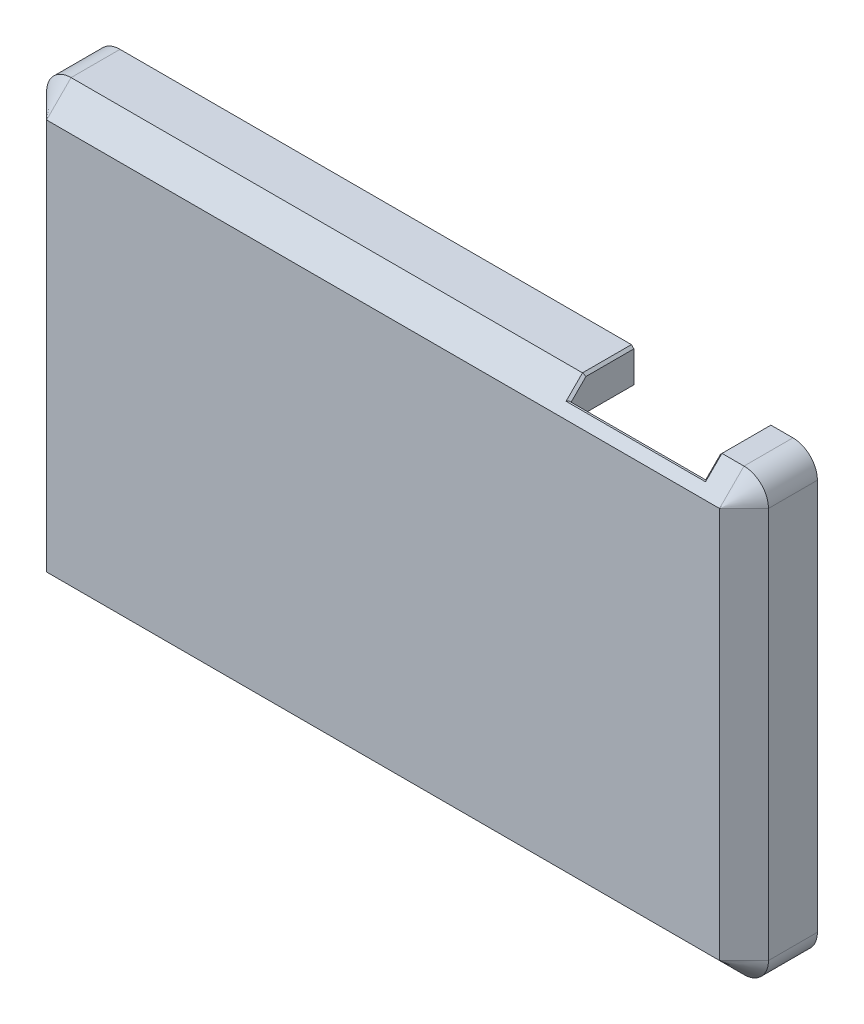
from build123d import *
from OCP.BRepFilletAPI import BRepFilletAPI_MakeChamfer

# Parameters (mm, degrees)
SKETCH_1_W          = 59
SKETCH_1_H          = 36
EXTRUDE_1_DEPTH     = 6
SKETCH_2_W          = 53.5
SKETCH_2_H          = 30.5
CUT_EXTRUDE_1_DEPTH = 5.2
FILLET_1_R          = 2
SKETCH_3_W          = 4
SKETCH_3_H          = 30.5
EXTRUDE_2_DEPTH     = 3.7
FILLET_2_R          = 4
CHAMFER_1_SIZE      = 2
SKETCH_4_W          = 11
SKETCH_4_H          = 5.2
CUT_EXTRUDE_2_DEPTH = 10
FILLET_3_R          = 0.2
CHAMFER_2_SIZE      = 0.2
CHAMFER_2_SIZE_2    = 0.141421356
M1_2X0_25_1_D       = 0.95
M1_2X0_25_1_DEPTH   = 3
M1_2X0_25_1_TIP     = 0.285408794


with BuildPart() as part:
    # 草图1 → 凸台-拉伸1 (new body)
    with BuildSketch(Plane.XY):
        Rectangle(SKETCH_1_W, SKETCH_1_H)
    extrude(amount=EXTRUDE_1_DEPTH)

    # 草图2 → 切除-拉伸1 (cut)
    with BuildSketch(Plane(origin=(0, 0, 0), x_dir=(-1, 0, 0), z_dir=(0, 0, -1))):
        Rectangle(SKETCH_2_W, SKETCH_2_H)
    extrude(amount=-CUT_EXTRUDE_1_DEPTH, mode=Mode.SUBTRACT)

    # 圆角1
    fillet_1_edges = [part.edges().sort_by_distance(p)[0] for p in [
        (29.5, -18, 3),
        (-29.5, -18, 3),
        (-29.5, 18, 3),
        (29.5, 18, 3),
    ]]
    fillet(fillet_1_edges, radius=FILLET_1_R)

    # 草图3 → 凸台-拉伸2 (add)
    with BuildSketch(Plane(origin=(0, 0, 5.2), x_dir=(-1, 0, 0), z_dir=(0, 0, -1))):
        with Locations((13.75, 0)):
            Rectangle(SKETCH_3_W, SKETCH_3_H)
    extrude(amount=EXTRUDE_2_DEPTH)

    # 圆角2
    fillet_2_edges = [part.edges().sort_by_distance(p)[0] for p in [
        (-15.75, -15.25, 3.35),
        (-15.75, 15.25, 3.35),
        (-11.75, 15.25, 3.35),
        (-11.75, -15.25, 3.35),
    ]]
    fillet(fillet_2_edges, radius=FILLET_2_R)

    # 倒角1
    chamfer_1_edges = [part.edges().sort_by_distance(p)[0] for p in [
        (-29.5, 0, 6),
        (0, 18, 6),
        (29.5, 0, 6),
        (0, -18, 6),
        (28.914213562, -17.414213562, 6),
        (28.914213562, 17.414213562, 6),
        (-28.914213562, -17.414213562, 6),
        (-28.914213562, 17.414213562, 6),
    ]]
    chamfer(chamfer_1_edges, length=CHAMFER_1_SIZE)

    # 草图4 → 切除-拉伸2 (cut)
    with BuildSketch(Plane(origin=(0, 18, 0), x_dir=(1, 0, 0), z_dir=(0, 1, 0))):
        with Locations((20, -2.6)):
            Rectangle(SKETCH_4_W, SKETCH_4_H)
    extrude(amount=-CUT_EXTRUDE_2_DEPTH, mode=Mode.SUBTRACT)

    # 圆角3
    fillet_3_edges = [part.edges().sort_by_distance(p)[0] for p in [
        (-26.75, 15.25, 2.6),
        (-26.75, -15.25, 2.6),
        (26.75, -15.25, 2.6),
        (26.75, 15.25, 2.6),
    ]]
    fillet(fillet_3_edges, radius=FILLET_3_R)

    # 倒角2
    chamfer_2_edges_1 = [part.edges().sort_by_distance(p)[0] for p in [
        (14.5, 17.4, 4.6),
        (25.5, 17.4, 4.6),
        (25.5, 18, 2),
        (14.5, 18, 2),
    ]]
    chamfer_2_edges_2 = [part.edges().sort_by_distance(p)[0] for p in [
        (20, 16.8, 5.2),
    ]]
    chamfer_2_side_2 = [part.faces().sort_by_distance(p)[0] for p in [
        (20, 16.797171573, 5.2),
    ]]
    chamfer_2 = BRepFilletAPI_MakeChamfer(part.part.solid().wrapped)
    for e in chamfer_2_edges_1:
        chamfer_2.Add(CHAMFER_2_SIZE - 0.0001, e.wrapped)
    for e in chamfer_2_edges_2:
        chamfer_2.Add(CHAMFER_2_SIZE_2 - 0.0001, CHAMFER_2_SIZE - 0.0001, e.wrapped, chamfer_2_side_2[0].wrapped)
    add(Compound.cast(chamfer_2.Shape()), mode=Mode.REPLACE)  # a hair under: the kernel refuses the full size

    # M1.2x0.25 螺纹孔1
    with Locations(Plane(origin=(27.5, 16.5, 0), x_dir=(-1, 0, 0), z_dir=(0, 0, -1))):
        with Locations((0, 0), (0, -33), (55, -33), (55, 0)):
            Hole(M1_2X0_25_1_D / 2, depth=M1_2X0_25_1_DEPTH)
            with Locations((0, 0, -(M1_2X0_25_1_DEPTH + M1_2X0_25_1_TIP / 2))):  # 118° drill point
                Cone(0, M1_2X0_25_1_D / 2, M1_2X0_25_1_TIP, mode=Mode.SUBTRACT)


solid = part.part
